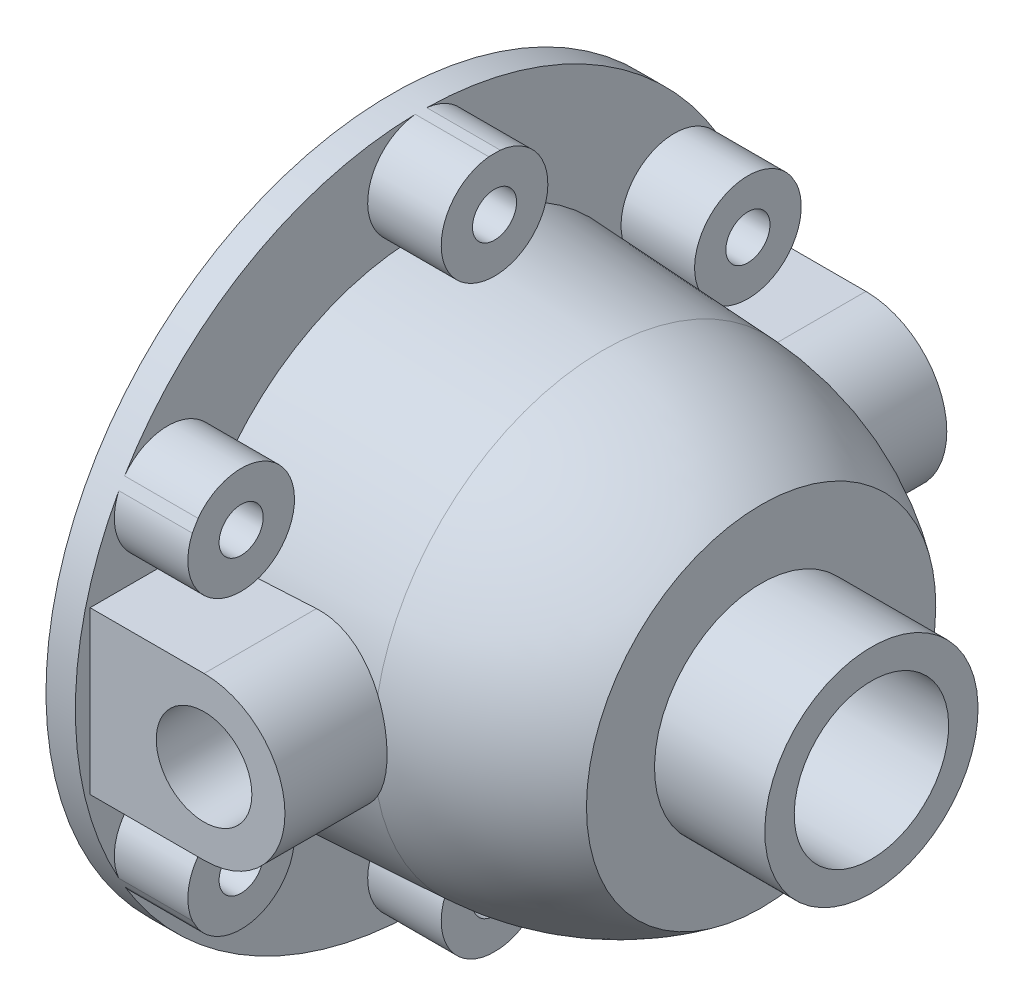
from build123d import *
from build123d.topology import SkipClean

# Parameters (mm, degrees)
THICKEN1_T2             = 4
SKETCH2_R               = 3
BOSS_EXTRUDE1_DEPTH     = 10
SKETCH4_R               = 3
CUT_EXTRUDE1_DEPTH      = 91.385632155
CIRPATTERN1_COUNT       = 6
CUT_EXTRUDE2_DEPTH      = 94.14269966
CUT_EXTRUDE2_DEPTH_BACK = 5
SKETCH5_R               = 30.204141733
BOSS_EXTRUDE2_REACH     = 119.143
BOSS_EXTRUDE2_START     = 24
SKETCH7_R               = 13.5
SKETCH7_R_2             = 6.5
SKETCH8_R               = 6.5
CUT_EXTRUDE3_DEPTH      = 108.273307491
BOSS_EXTRUDE3_REACH     = 140.143
BOSS_EXTRUDE3_START     = 45
SKETCH9_R               = 6.5
BOSS_EXTRUDE12_REACH    = 140.143
BOSS_EXTRUDE12_START    = -45
SKETCH9_8_R             = 6.5
SKETCH15_R              = 6.5
CUT_EXTRUDE4_DEPTH      = 94.14269966


with BuildPart() as body_1:
    # Surface-Revolve1: a surface, the sketch's curves turned about an axis
    with BuildLine(Plane.XY, mode=Mode.PRIVATE) as surface_revolve1_1_path:
        Line((0, 14.5), (-15, 14.5))
        Line((-15, 14.5), (-15, 23.75))
        ThreePointArc((-15, 23.75), (-25.22234377, 28.998625985), (-36.5, 31.202907463))
        Line((-36.5, 31.202907463), (-61.25, 32.5))
        Line((-61.25, 32.5), (-61.25, 47))
    surface_revolve1_1 = Shell.revolve(surface_revolve1_1_path.wire(), 360, Axis((30.911665795, 0, 0), (-1, 0, 0)))
    add(Solid.thicken(surface_revolve1_1, -THICKEN1_T2))

    # Sketch2 → Boss-Extrude1 (add)
    with BuildSketch(Plane(origin=(-61.25, 0, 0), x_dir=(0, 0, -1), z_dir=(1, 0, 0))):
        with BuildLine():
            ThreePointArc((-0.780227017, 46.993523445), (-4.842822221, 34.390299952), (7.25, 39.785628759))
            ThreePointArc((7.25, 39.785628759), (5.395328807, 44.62845098), (0.780227017, 46.993523445))
            ThreePointArc((0.780227017, 46.993523445), (0, 47), (-0.780227017, 46.993523445))
        make_face()
        with Locations(Location((0, 39.785628759, 0), (0, 0, 90))):
            Circle(SKETCH2_R, mode=Mode.SUBTRACT)
    boss_extrude1 = extrude(amount=BOSS_EXTRUDE1_DEPTH)

    # Sketch4 → Cut-Extrude1 (cut, symmetric)
    with BuildSketch(Plane(origin=(-61.25, 0, 0), x_dir=(0, 0, -1), z_dir=(1, 0, 0))):
        with Locations(Location((0, 39.785628759, 0), (0, 0, 90))):
            Circle(SKETCH4_R)
    cut_extrude1 = extrude(amount=CUT_EXTRUDE1_DEPTH, both=True, mode=Mode.SUBTRACT)

    # CirPattern1: Boss-Extrude1, Cut-Extrude1 ×6 about axis
    with SkipClean():  # the faces are left unmerged after this step: merging them gives an invalid solid
        cirpattern1_axis = Axis((0, 0, 0), (1, 0, 0))
        add([boss_extrude1.rotate(cirpattern1_axis, i * 360 / CIRPATTERN1_COUNT) for i in range(1, CIRPATTERN1_COUNT)])
        add([cut_extrude1.rotate(cirpattern1_axis, i * 360 / CIRPATTERN1_COUNT) for i in range(1, CIRPATTERN1_COUNT)], mode=Mode.SUBTRACT)

    # Sketch5 → Cut-Extrude2 (cut, two sides: drawn at the far end of the back side and taken through both)
    with SkipClean():  # the faces are left unmerged after this step: merging them gives an invalid solid
        with BuildSketch(Plane.ZY.offset(65.25).offset(-CUT_EXTRUDE2_DEPTH_BACK)):
            with Locations(Location((0, 0, 0), (0, 0, 90))):
                Circle(SKETCH5_R)
        extrude(amount=CUT_EXTRUDE2_DEPTH + CUT_EXTRUDE2_DEPTH_BACK, mode=Mode.SUBTRACT)

    # Sketch7 → Boss-Extrude2 (add, up to next)
    with BuildSketch(Plane.XY.offset(BOSS_EXTRUDE2_START), mode=Mode.PRIVATE) as boss_extrude2_sk1:
        with Locations(Location((-45.75, 0, 0), (0, 0, 47.957764305))):
            Circle(SKETCH7_R)
        with Locations(Location((-45.75, 0, 0), (0, 0, 226.970365887))):
            Circle(SKETCH7_R_2, mode=Mode.SUBTRACT)
    boss_extrude2_tool1 = extrude(boss_extrude2_sk1.sketch, amount=BOSS_EXTRUDE2_REACH, mode=Mode.PRIVATE) - body_1.part
    add(boss_extrude2_tool1.solids().sort_by_distance((-54.534948, -9.742221, 24))[0])

    # Sketch8 → Cut-Extrude3 (cut, through all)
    with SkipClean():  # the faces are left unmerged after this step: merging them gives an invalid solid
        with BuildSketch(Plane(origin=(0, 0, 24), x_dir=(-1, 0, 0), z_dir=(0, 0, -1))):
            with Locations(Location((45.75, 0, 0), (0, 0, 313.400202048))):
                Circle(SKETCH8_R)
        extrude(amount=-CUT_EXTRUDE3_DEPTH, mode=Mode.SUBTRACT)

    # Boss-Extrude3: up to this cone (the profile starts outside it)
    with SkipClean():  # the faces are left unmerged after this step: merging them gives an invalid solid
        boss_extrude3_end = Plane(origin=(-60.90558, 0, 0), z_dir=(-1, 0, 0)) * Cone(23.40885556, 41.555043866, 346.249899425, mode=Mode.PRIVATE)
        # Sketch9 → Boss-Extrude3 (add, up to the surface)
        with BuildSketch(Plane.XY.offset(BOSS_EXTRUDE3_START), mode=Mode.PRIVATE) as boss_extrude3_sk1:
            with BuildLine():
                Line((-61.25, -11), (-61.25, 11))
                Line((-61.25, 11), (-45.75, 11))
                ThreePointArc((-45.75, 11), (-34.75, 0), (-45.75, -11))
                Line((-45.75, -11), (-61.25, -11))
            make_face()
            with Locations((-45.75, 0)):
                Circle(SKETCH9_R, mode=Mode.SUBTRACT)
        boss_extrude3_tool1 = extrude(boss_extrude3_sk1.sketch, amount=-BOSS_EXTRUDE3_REACH, mode=Mode.PRIVATE) - boss_extrude3_end
        add(boss_extrude3_tool1.solids().sort_by_distance((-60.90558, 0, 45))[0])

    # Boss-Extrude12: up to this cone (the profile starts outside it)
    with SkipClean():  # the faces are left unmerged after this step: merging them gives an invalid solid
        boss_extrude12_end = Plane(origin=(-60.90558, 0, 0), z_dir=(-1, 0, 0)) * Cone(23.40885556, 41.555043866, 346.249899425, mode=Mode.PRIVATE)
        # Sketch9<8> → Boss-Extrude12 (add, up to the surface)
        with BuildSketch(Plane.XY.offset(BOSS_EXTRUDE12_START), mode=Mode.PRIVATE) as boss_extrude12_sk1:
            with BuildLine():
                Line((-61.25, -11), (-61.25, 11))
                Line((-61.25, 11), (-45.75, 11))
                ThreePointArc((-45.75, 11), (-34.75, 0), (-45.75, -11))
                Line((-45.75, -11), (-61.25, -11))
            make_face()
            with Locations((-45.75, 0)):
                Circle(SKETCH9_8_R, mode=Mode.SUBTRACT)
        boss_extrude12_tool1 = extrude(boss_extrude12_sk1.sketch, amount=BOSS_EXTRUDE12_REACH, mode=Mode.PRIVATE) - boss_extrude12_end
        add(boss_extrude12_tool1.solids().sort_by_distance((-60.90558, 0, -45))[0])

    # Sketch15 → Cut-Extrude4 (cut, through all)
    with SkipClean():  # the faces are left unmerged after this step: merging them gives an invalid solid
        with BuildSketch(Plane.XY):
            with Locations((-45.75, 0)):
                Circle(SKETCH15_R)
        extrude(amount=-CUT_EXTRUDE4_DEPTH, mode=Mode.SUBTRACT)


solid = body_1.part
